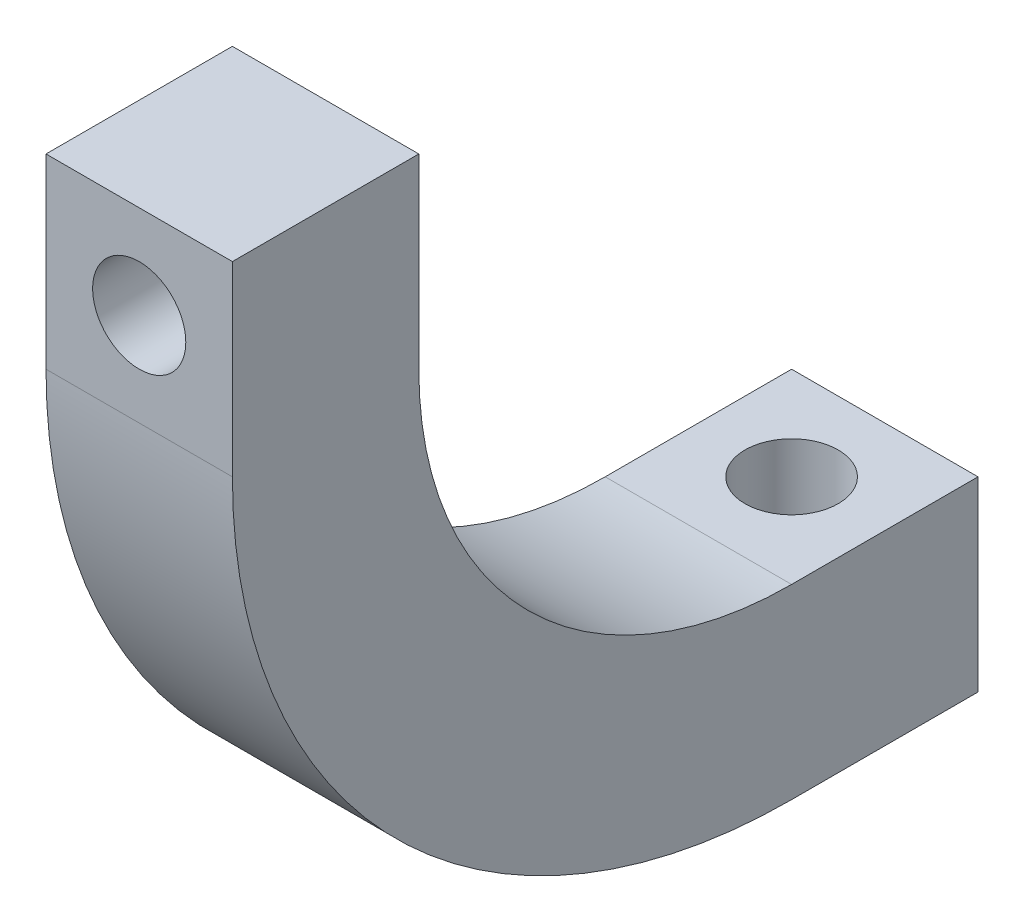
from build123d import *

# Parameters (mm, degrees)
BOSS_EXTRUDE1_DEPTH      = 3
BOSS_EXTRUDE1_DEPTH_BACK = 3
SKETCH7_R                = 1.5
CUT_EXTRUDE1_DEPTH       = 30.849623113
SKETCH8_R                = 1.5
CUT_EXTRUDE2_DEPTH       = 30.849623113


with BuildPart() as part:
    # Sketch5 → Boss-Extrude1 (new, two sides: drawn at the far end of the back side and taken through both)
    with BuildSketch(Plane(origin=(0, 0, 0), x_dir=(0, 0, -1), z_dir=(1, 0, 0)).offset(-BOSS_EXTRUDE1_DEPTH_BACK)):
        with BuildLine():
            Line((-15, 3), (-15, 0))
            Line((-15, 0), (-15, -3))
            ThreePointArc((-15, -3), (-11.485281374, -11.485281374), (-3, -15))
            Line((-3, -15), (0, -15))
            Line((0, -15), (3, -15))
            Line((3, -15), (3, -21))
            Line((3, -21), (-3, -21))
            ThreePointArc((-3, -21), (-15.727922061, -15.727922061), (-21, -3))
            Line((-21, -3), (-21, 3))
            Line((-21, 3), (-15, 3))
        make_face()
    extrude(amount=BOSS_EXTRUDE1_DEPTH + BOSS_EXTRUDE1_DEPTH_BACK)

    # Sketch7 → Cut-Extrude1 (cut, through all)
    with BuildSketch(Plane.XY):
        Circle(SKETCH7_R)
    extrude(amount=CUT_EXTRUDE1_DEPTH, mode=Mode.SUBTRACT)

    # Sketch8 → Cut-Extrude2 (cut, through all)
    with BuildSketch(Plane(origin=(0, 0, 0), x_dir=(1, 0, 0), z_dir=(0, 1, 0))):
        Circle(SKETCH8_R)
    extrude(amount=-CUT_EXTRUDE2_DEPTH, mode=Mode.SUBTRACT)


solid = part.part
